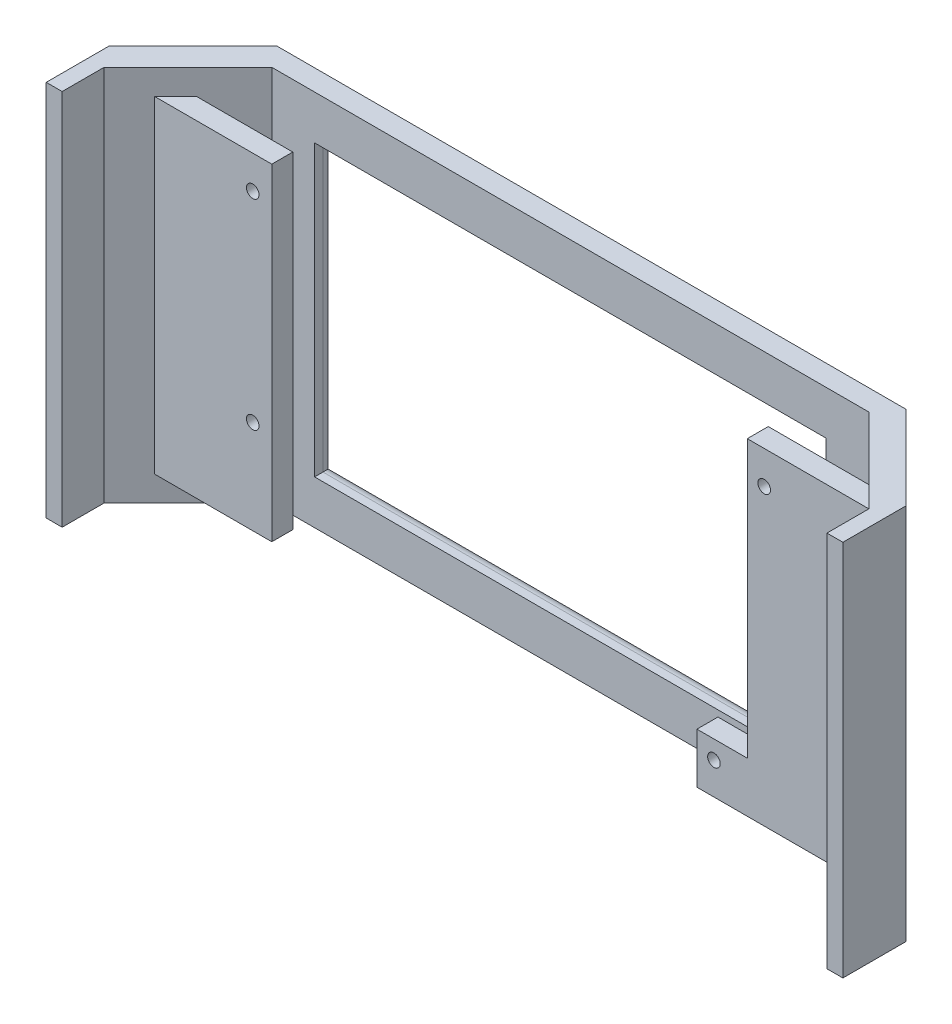
from build123d import *

# Parameters (mm, degrees)
SKETCH1_W           = 190
SKETCH1_H           = 90
SKETCH1_W_2         = 122
SKETCH1_H_2         = 69
BOSS_EXTRUDE1_DEPTH = 5
SKETCH2_W           = 3.8
SKETCH2_H           = 90
BOSS_EXTRUDE2_DEPTH = 30
SKETCH3_W           = 34
SKETCH3_H           = 5
SKETCH3_W_2         = 47
BOSS_EXTRUDE3_DEPTH = 90
SKETCH4_W           = 182.4
SKETCH4_H           = 6
CUT_EXTRUDE1_DEPTH  = 5
SKETCH5_R           = 1.5
CUT_EXTRUDE2_DEPTH  = 5
SKETCH6_W           = 12
SKETCH6_H           = 66
CUT_EXTRUDE3_DEPTH  = 5
FILLET3_R           = 3
CHAMFER6_SIZE       = 20


with BuildPart() as part:
    # Sketch1 → Boss-Extrude1 (new body)
    with BuildSketch(Plane.XY):
        Rectangle(SKETCH1_W, SKETCH1_H)
        Rectangle(SKETCH1_W_2, SKETCH1_H_2, mode=Mode.SUBTRACT)
    extrude(amount=BOSS_EXTRUDE1_DEPTH)

    # Sketch2 → Boss-Extrude2 (add)
    with BuildSketch(Plane.XY.offset(5)):
        with Locations((-93.1, 0)):
            Rectangle(SKETCH2_W, SKETCH2_H)
        with Locations((93.1, 0)):
            Rectangle(SKETCH2_W, SKETCH2_H)
    extrude(amount=BOSS_EXTRUDE2_DEPTH)

    # Sketch3 → Boss-Extrude3 (add)
    with BuildSketch(Plane(origin=(0, 45, 0), x_dir=(1, 0, 0), z_dir=(0, 1, 0))):
        with Locations((-74.2, -16.5)):
            Rectangle(SKETCH3_W, SKETCH3_H)
        with Locations((67.7, -16.5)):
            Rectangle(SKETCH3_W_2, SKETCH3_H)
    extrude(amount=-BOSS_EXTRUDE3_DEPTH)

    # Sketch4 → Cut-Extrude1 (cut)
    with BuildSketch(Plane.XY.offset(19)):
        with Locations((0, 42)):
            Rectangle(SKETCH4_W, SKETCH4_H)
        with Locations((0, -42)):
            Rectangle(SKETCH4_W, SKETCH4_H)
    extrude(amount=-CUT_EXTRUDE1_DEPTH, mode=Mode.SUBTRACT)

    # Sketch5 → Cut-Extrude2 (cut)
    with BuildSketch(Plane.XY.offset(19)):
        with Locations((-61.75, 31.13)):
            Circle(SKETCH5_R)
        with Locations((-61.75, -16.61)):
            Circle(SKETCH5_R)
        with Locations((60.23, 31.13)):
            Circle(SKETCH5_R)
        with Locations((48.25, -31.38)):
            Circle(SKETCH5_R)
    extrude(amount=-CUT_EXTRUDE2_DEPTH, mode=Mode.SUBTRACT)

    # Sketch6 → Cut-Extrude3 (cut)
    with BuildSketch(Plane.XY.offset(19)):
        with Locations((50.2, 6)):
            Rectangle(SKETCH6_W, SKETCH6_H)
    extrude(amount=-CUT_EXTRUDE3_DEPTH, mode=Mode.SUBTRACT)

    # Fillet3
    fillet3_edges = [part.edges().sort_by_distance(p)[0] for p in [
        (61, 0, 0),
        (0, 34.5, 0),
        (-61, 0, 0),
        (0, -34.5, 0),
    ]]
    fillet(fillet3_edges, radius=FILLET3_R)

    # Chamfer6
    # the kernel refuses this chamfer: 20 mm, written as the material it adds along each edge
    with BuildSketch(Plane(origin=(-91.2, 45, 5), x_dir=(-0.027495876610586317, 0, 0.9996219169112968), z_dir=(0, -1, 0))) as chamfer6_piece_1:
        Polygon((CHAMFER6_SIZE * 0.999621916911, -CHAMFER6_SIZE * 0.0274958766106), (-CHAMFER6_SIZE * 0.0274958766106, -CHAMFER6_SIZE * 0.999621916911), (0, 0), align=None)
    extrude(amount=90)
    with BuildSketch(Plane(origin=(91.2, -45, 5), x_dir=(-0.9996219169112968, 0, -0.02749587661058636), z_dir=(0, 1, 0))) as chamfer6_piece_2:
        Polygon((CHAMFER6_SIZE * 0.999621916911, CHAMFER6_SIZE * 0.0274958766106), (-CHAMFER6_SIZE * 0.0274958766106, CHAMFER6_SIZE * 0.999621916911), (0, 0), align=None)
    extrude(amount=90)
    # the kernel refuses this chamfer: 20 mm, written as the material it takes off along each edge
    with BuildSketch(Plane(origin=(-95, -96.433659759, 0), x_dir=(0.9996219169112968, 0, -0.027495876610586372), z_dir=(0, 1, 0)), Plane(origin=(95, 96.433659759, 0), x_dir=(-0.9996219169112968, 0, -0.027495876610586372), z_dir=(0, -1, 0))) as chamfer6_2_piece_1:
        Polygon((CHAMFER6_SIZE * 0.999621916911, -CHAMFER6_SIZE * 0.0274958766106), (-CHAMFER6_SIZE * 0.0274958766106, -CHAMFER6_SIZE * 0.999621916911), (0, 0), align=None)
    extrude(amount=192.867319519, mode=Mode.SUBTRACT)


solid = part.part
